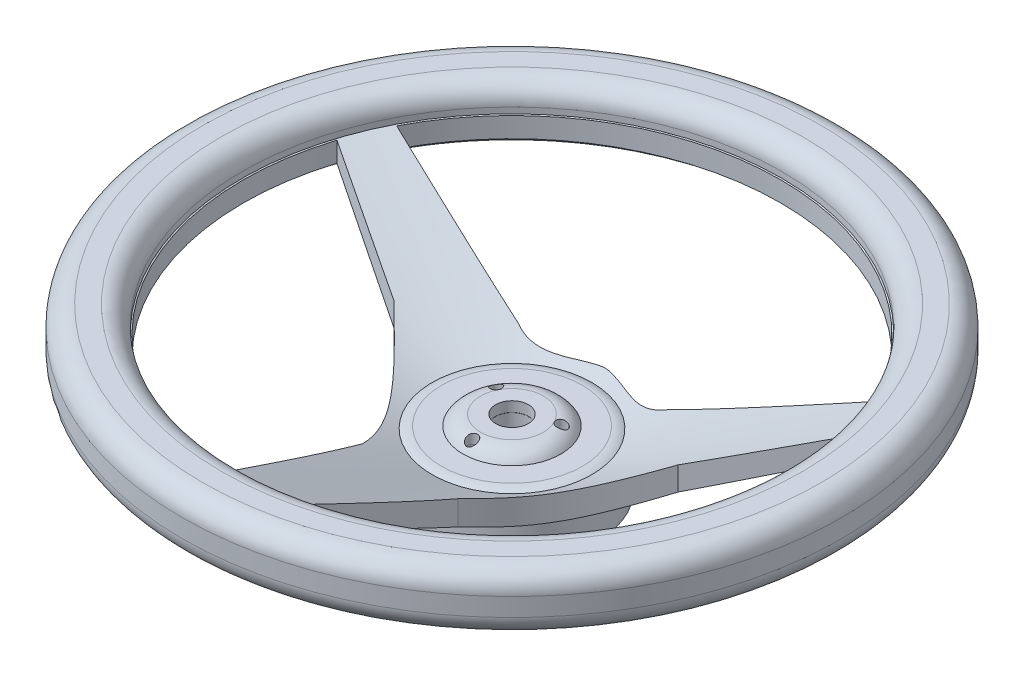
from build123d import *

# Parameters (mm, degrees)
SKETCH1_R               = 162.5
BOSS_EXTRUDE1_DEPTH     = 80
CUT_EXTRUDE1_DEPTH      = 1
CUT_EXTRUDE1_DEPTH_BACK = 80
SKETCH2_R               = 8
SKETCH2_R_2             = 2.761358611
CUT_EXTRUDE2_DEPTH      = 11
CUT_EXTRUDE2_DEPTH_BACK = 52
SKETCH2_3_R             = 40
SKETCH2_3_R_2           = 2.761358611
SKETCH2_3_R_3           = 8
SKETCH3_W               = 30
SKETCH3_H               = 51.028933458
FILLET1_R               = 10
FILLET2_R               = 10
SKETCH10_R              = 38.678603439
SKETCH10_R_2            = 21.813372584
CUT_EXTRUDE4_DEPTH      = 20
SKETCH11_R              = 18.450471484
CUT_EXTRUDE5_DEPTH      = 20
FILLET3_R               = 10
FILLET5_R               = 10
SKETCH14_R              = 6
BOSS_EXTRUDE4_DEPTH     = 20
SKETCH16_R              = 2.76
CUT_EXTRUDE6_DEPTH      = 70
SKETCH17_R              = 24.134850835
BOSS_EXTRUDE6_DEPTH     = 5
SKETCH18_R              = 8.095194388
SKETCH18_R_2            = 2.672357326
CUT_EXTRUDE7_DEPTH      = 5


with BuildPart() as part:
    # Sketch1 → Boss-Extrude1 (new body)
    with BuildSketch(Plane(origin=(0, 0, 0), x_dir=(1, 0, 0), z_dir=(0, 1, 0))):
        with Locations(Location((0, 0, 0), (0, 0, 270))):
            Circle(SKETCH1_R)
    extrude(amount=BOSS_EXTRUDE1_DEPTH)

    # Sketch2 → Cut-Extrude1 (cut, two sides: drawn at the far end of the back side and taken through both)
    with BuildSketch(Plane(origin=(0, 80, 0), x_dir=(1, 0, 0), z_dir=(0, 1, 0)).offset(-CUT_EXTRUDE1_DEPTH_BACK)):
        with Locations(Location((0, 0, 0), (0, 0, 270))):
            Circle(SKETCH2_R)
        with Locations(Location((0, -19.65304297, 0), (0, 0, 270))):
            Circle(SKETCH2_R_2)
        with Locations(Location((16.15400907, 8.326521485, 0), (0, 0, 270))):
            Circle(SKETCH2_R_2)
        with Locations(Location((-16.15400907, 8.326521485, 0), (0, 0, 270))):
            Circle(SKETCH2_R_2)
        with BuildLine():
            Line((-117.713081845, 60.826641881), (-36.674339972, 40))
            add(Edge.make_bspline(
                [(-36.674339972, 40), (-24.142328756, 34.531173185), (-12.260944771, 45.184855451), (0, 46.006258612)],
                knots=[0, 0, 0, 0, 1, 1, 1, 1], degree=3))
            add(Edge.make_bspline(
                [(36.674339972, 40), (24.142328756, 34.531173185), (12.260944771, 45.184855451), (0, 46.006258612)],
                knots=[0, 0, 0, 0, 1, 1, 1, 1], degree=3))
            Line((36.674339972, 40), (117.713081845, 60.826641881))
            ThreePointArc((117.713081845, 60.826641881), (0, 132.5), (-117.713081845, 60.826641881))
        make_face()
        with BuildLine():
            Line((-126.318050967, 40), (-70.062977086, 11.87088277))
            add(Edge.make_bspline(
                [(-70.062977086, 11.87088277), (-51.521568963, -6.441147877), (-32.431239094, -23.82383654), (-23.489801243, -50.092588857)],
                knots=[0, 0, 0, 0, 1, 1, 1, 1], degree=3))
            Line((-23.489801243, -50.092588857), (-13.52545882, -131.807860023))
            ThreePointArc((-13.52545882, -131.807860023), (-110.763428074, -72.716662474), (-126.318050967, 40))
        make_face()
        with BuildLine():
            Line((23.489801243, -50.092588857), (13.52545882, -131.807860023))
            ThreePointArc((13.52545882, -131.807860023), (110.763428074, -72.716662474), (126.318050967, 40))
            Line((126.318050967, 40), (70.062977086, 11.87088277))
            add(Edge.make_bspline(
                [(70.062977086, 11.87088277), (51.521568963, -6.441147877), (32.431239094, -23.82383654), (23.489801243, -50.092588857)],
                knots=[0, 0, 0, 0, 1, 1, 1, 1], degree=3))
        make_face()
    extrude(amount=CUT_EXTRUDE1_DEPTH + CUT_EXTRUDE1_DEPTH_BACK, mode=Mode.SUBTRACT)

    # Sketch2<3> → Cut-Extrude2 (cut, two sides: drawn at the far end of the back side and taken through both)
    with BuildSketch(Plane(origin=(0, 80, 0), x_dir=(1, 0, 0), z_dir=(0, 1, 0)).offset(-CUT_EXTRUDE2_DEPTH_BACK)):
        with Locations(Location((0, 0, 0), (0, 0, 270))):
            Circle(SKETCH2_3_R)
        with Locations(Location((-16.15400907, 8.326521485, 0), (0, 0, 270))):
            Circle(SKETCH2_3_R_2, mode=Mode.SUBTRACT)
        with Locations(Location((16.15400907, 8.326521485, 0), (0, 0, 270))):
            Circle(SKETCH2_3_R_2, mode=Mode.SUBTRACT)
        with Locations(Location((0, -19.65304297, 0), (0, 0, 270))):
            Circle(SKETCH2_3_R_2, mode=Mode.SUBTRACT)
        with Locations(Location((0, 0, 0), (0, 0, 270))):
            Circle(SKETCH2_3_R_3, mode=Mode.SUBTRACT)
    extrude(amount=CUT_EXTRUDE2_DEPTH + CUT_EXTRUDE2_DEPTH_BACK, mode=Mode.SUBTRACT)

    # Sketch3 → Cut-Revolve3 (revolve, cut)
    with BuildSketch(Plane(origin=(0, 0, 0), x_dir=(0, 0, -1), z_dir=(1, 0, 0)), mode=Mode.PRIVATE) as cut_revolve3_sk:
        with Locations((-147.5, 25.514466729)):
            Rectangle(SKETCH3_W, SKETCH3_H)
    revolve(cut_revolve3_sk.sketch.rotate(Axis((0, 0, 0), (0, 1, 0)), 180), axis=Axis((0, 0, 0), (0, 1, 0)), mode=Mode.SUBTRACT)

    # Fillet1
    fillet1_edges = [part.edges().sort_by_distance(p)[0] for p in [
        (0, 80, -162.5),
    ]]
    fillet(fillet1_edges, radius=FILLET1_R)

    # Fillet2
    fillet2_edges = [part.edges().sort_by_distance(p)[0] for p in [
        (0, 51.028933458, -162.5),
    ]]
    fillet(fillet2_edges, radius=FILLET2_R)

    # Sketch10 → Cut-Extrude4 (cut)
    with BuildSketch(Plane.XZ):
        with Locations(Location((0, 0, 0), (0, 0, 270))):
            Circle(SKETCH10_R)
        Circle(SKETCH10_R_2, mode=Mode.SUBTRACT)
    extrude(amount=-CUT_EXTRUDE4_DEPTH, mode=Mode.SUBTRACT)

    # Sketch11 → Cut-Extrude5 (cut)
    with BuildSketch(Plane.XZ):
        Circle(SKETCH11_R)
    extrude(amount=-CUT_EXTRUDE5_DEPTH, mode=Mode.SUBTRACT)

    # Sketch12 → Cut-Revolve6 (revolve, cut)
    with BuildSketch(Plane.XY, mode=Mode.PRIVATE) as cut_revolve6_sk:
        Polygon((-126.318050967, -0.046068332), (-42.279322928, -0.016341525), (-42.279322928, 15.659953961), (-133.918896166, 57.568138299), (-133.918896166, -0.046068332), align=None)
    revolve(cut_revolve6_sk.sketch.rotate(Axis((0, 0, 0), (0, 1, 0)), 270), axis=Axis((0, 0, 0), (0, 1, 0)), mode=Mode.SUBTRACT)

    # Sketch13 → Cut-Revolve8 (revolve, cut)
    with BuildSketch(Plane.XY, mode=Mode.PRIVATE) as cut_revolve8_sk:
        Polygon((-39.371387043, 26.827106401), (-133.140075977, 67.093294529), (-133.140075977, 80.027889937), (-39.371387043, 80.027889937), align=None)
    revolve(cut_revolve8_sk.sketch.rotate(Axis((0, 0, 0), (0, 1, 0)), 270), axis=Axis((0, 0, 0), (0, 1, 0)), mode=Mode.SUBTRACT)

    # Fillet3
    fillet3_edges = [part.edges().sort_by_distance(p)[0] for p in [
        (0, 80, 133.140075977),
    ]]
    fillet(fillet3_edges, radius=FILLET3_R)

    # Fillet4: read off the stored shape, not the designer's step
    # Fillet4 outline → Fillet4 (revolve, cut)
    with BuildSketch(Plane.XY):
        with BuildLine():
            Line((133.918896166, 51.028933458), (143.300948014, 51.028933458))
            ThreePointArc((143.300948014, 51.028933458), (137.582904274, 52.825033422), (133.918896166, 57.568138299))
            Line((133.918896166, 57.568138299), (133.918896166, 51.028933458))
        make_face()
    revolve(axis=Axis((0, 0, 0), (0, 1, 0)), mode=Mode.SUBTRACT)

    # Fillet5
    # the kernel refuses this fillet: 10 mm, written as the material it takes off along each edge
    with BuildSketch(Plane(origin=(0, 28, 0), x_dir=(0, 0, -1), z_dir=(-1, 0, 0))) as fillet5_piece_1:
        with BuildLine():
            CenterArc((34.672217692, 10), FILLET5_R, 270, 28.028904748)
            Line((34.672217692, 0), (34.672217692, -0.2))
            Line((34.672217692, -0.2), (39.371387043, -0.2))
            Line((39.371387043, -0.2), (39.571387043, 0))
            ThreePointArc((39.571387043, 0), (39.571387043, 0.5864468), (39.46537043, 0.996351471))
            Line((39.46537043, 0.996351471), (39.371387043, 1.172893599))
        make_face()
    revolve(axis=Axis((0, 28, 0), (0, -1, 0)), mode=Mode.SUBTRACT)

    # Sketch14 → Boss-Extrude4 (add)
    with BuildSketch(Plane(origin=(0, 0, 0), x_dir=(1, 0, 0), z_dir=(0, 1, 0))):
        with Locations((-16.154009071, 8.326521486)):
            Circle(SKETCH14_R)
        with Locations((16.154009071, 8.326521486)):
            Circle(SKETCH14_R)
        with Locations((0, -19.653042971)):
            Circle(SKETCH14_R)
    extrude(amount=BOSS_EXTRUDE4_DEPTH)

    # Sketch16 → Cut-Extrude6 (cut)
    with BuildSketch(Plane(origin=(0, 0, 0), x_dir=(-1, 0, 0), z_dir=(0, -1, 0))):
        with Locations(Location((0, -19.653042971, 0), (0, 0, 90))):
            Circle(SKETCH16_R)
        with Locations(Location((-16.154009071, 8.326521486, 0), (0, 0, 90))):
            Circle(SKETCH16_R)
        with Locations(Location((16.154009071, 8.326521486, 0), (0, 0, 90))):
            Circle(SKETCH16_R)
    extrude(amount=-CUT_EXTRUDE6_DEPTH, mode=Mode.SUBTRACT)


with BuildPart() as body_2:
    # Sketch17 → Boss-Extrude6 (new body)
    with BuildSketch(Plane(origin=(0, 28, 0), x_dir=(1, 0, 0), z_dir=(0, 1, 0))):
        with Locations(Location((0, 0, 0), (0, 0, 270))):
            Circle(SKETCH17_R)
    extrude(amount=BOSS_EXTRUDE6_DEPTH)

    # Sketch18 → Cut-Extrude7 (cut)
    with BuildSketch(Plane(origin=(0, 33, 0), x_dir=(1, 0, 0), z_dir=(0, 1, 0))):
        with Locations(Location((0, 0, 0), (0, 0, 270))):
            Circle(SKETCH18_R)
        with Locations(Location((0, -19.653042971, 0), (0, 0, 270))):
            Circle(SKETCH18_R_2)
        with Locations(Location((-16.154009071, 8.326521486, 0), (0, 0, 270))):
            Circle(SKETCH18_R_2)
        with Locations(Location((16.154009071, 8.326521486, 0), (0, 0, 270))):
            Circle(SKETCH18_R_2)
    extrude(amount=-CUT_EXTRUDE7_DEPTH, mode=Mode.SUBTRACT)

    # Fillet6: read off the stored shape, not the designer's step
    # Fillet6 outline → Fillet6 (revolve, cut)
    with BuildSketch(Plane.XY):
        with BuildLine():
            Line((24.134850835, 33), (15.474596797, 33))
            ThreePointArc((15.474596797, 33), (20.474596797, 31.660254038), (24.134850835, 28))
            Line((24.134850835, 28), (24.134850835, 33))
        make_face()
    revolve(axis=Axis((0, 0, 0), (0, 1, 0)), mode=Mode.SUBTRACT)


solid = Compound([part.part, body_2.part])
